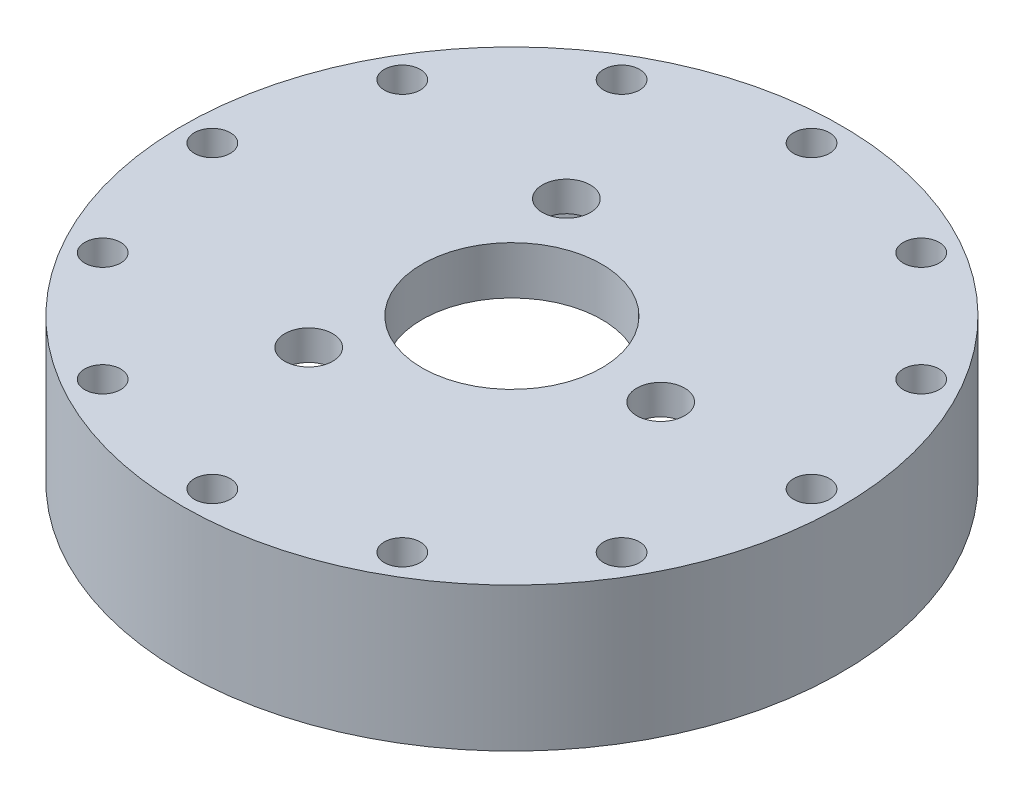
from build123d import *

# Parameters (mm, degrees)
SKETCH1_R           = 27.5
BOSS_EXTRUDE2_DEPTH = 8
SKETCH2_R           = 27.5
SKETCH2_R_2         = 7.5
SKETCH2_R_3         = 2
BOSS_EXTRUDE3_DEPTH = 4
FILLET2_R           = 1
SKETCH8_R           = 1.5
CUT_EXTRUDE1_DEPTH  = 41.700122985
SKETCH9_R           = 4.25
CUT_EXTRUDE2_DEPTH  = 1.5


with BuildPart() as part:
    # Sketch1 → Boss-Extrude2 (new body)
    with BuildSketch(Plane(origin=(0, 0, 0), x_dir=(1, 0, 0), z_dir=(0, 1, 0))):
        Circle(SKETCH1_R)
        with BuildLine():
            ThreePointArc((22.486051897, 0.792130095), (18.311696675, -2.632824508), (21.352039962, -7.095096155))
            ThreePointArc((21.352039962, -7.095096155), (20.466719895, -9.346837793), (19.34472846, -11.490495238))
            ThreePointArc((19.34472846, -11.490495238), (13.981367126, -12.114923578), (14.126580466, -17.512559046))
            ThreePointArc((14.126580466, -17.512559046), (12.164418393, -18.928204489), (10.06159042, -20.124969521))
            ThreePointArc((10.06159042, -20.124969521), (5.212052302, -17.750620012), (2.416031486, -22.369908177))
            ThreePointArc((2.416031486, -22.369908177), (0, -22.5), (-2.416031486, -22.369908177))
            ThreePointArc((-2.416031486, -22.369908177), (-5.212052302, -17.750620012), (-10.06159042, -20.124969521))
            ThreePointArc((-10.06159042, -20.124969521), (-12.164418393, -18.928204489), (-14.126580466, -17.512559046))
            ThreePointArc((-14.126580466, -17.512559046), (-13.981367126, -12.114923578), (-19.34472846, -11.490495238))
            ThreePointArc((-19.34472846, -11.490495238), (-20.466719895, -9.346837793), (-21.352039962, -7.095096155))
            ThreePointArc((-21.352039962, -7.095096155), (-18.311696675, -2.632824508), (-22.486051897, 0.792130095))
            ThreePointArc((-22.486051897, 0.792130095), (-22.270982442, 3.202083861), (-21.798377637, 5.575009634))
            ThreePointArc((-21.798377637, 5.575009634), (-16.828191914, 7.685177741), (-18.488212735, 12.82325972))
            ThreePointArc((-18.488212735, 12.82325972), (-17.004365423, 14.734366514), (-15.323884431, 16.475089254))
            ThreePointArc((-15.323884431, 16.475089254), (-10.001855123, 15.563190357), (-8.620496662, 20.783094988))
            ThreePointArc((-8.620496662, 20.783094988), (-6.338982529, 21.588591906), (-3.984166192, 22.144444444))
            ThreePointArc((-3.984166192, 22.144444444), (0, 18.5), (3.984166192, 22.144444444))
            ThreePointArc((3.984166192, 22.144444444), (6.338982529, 21.588591906), (8.620496662, 20.783094988))
            ThreePointArc((8.620496662, 20.783094988), (10.001855123, 15.563190357), (15.323884431, 16.475089254))
            ThreePointArc((15.323884431, 16.475089254), (17.004365423, 14.734366514), (18.488212735, 12.82325972))
            ThreePointArc((18.488212735, 12.82325972), (16.828191914, 7.685177741), (21.798377637, 5.575009634))
            ThreePointArc((21.798377637, 5.575009634), (22.270982442, 3.202083861), (22.486051897, 0.792130095))
        make_face(mode=Mode.SUBTRACT)
    extrude(amount=BOSS_EXTRUDE2_DEPTH)

    # Sketch2 → Boss-Extrude3 (add)
    with BuildSketch(Plane(origin=(0, 8, 0), x_dir=(1, 0, 0), z_dir=(0, 1, 0))):
        Circle(SKETCH2_R)
        Circle(SKETCH2_R_2, mode=Mode.SUBTRACT)
        with Locations((-6.206515394, 10.75)):
            Circle(SKETCH2_R_3, mode=Mode.SUBTRACT)
        with Locations((12.413030788, 0)):
            Circle(SKETCH2_R_3, mode=Mode.SUBTRACT)
        with Locations((-6.206515394, -10.75)):
            Circle(SKETCH2_R_3, mode=Mode.SUBTRACT)
    extrude(amount=BOSS_EXTRUDE3_DEPTH)

    # Fillet2
    fillet2_edges = [part.edges().sort_by_distance(p)[0] for p in [
        (19.34472846, 4, 11.490495238),
        (10.06159042, 4, 20.124969521),
        (2.416031486, 4, 22.369908177),
        (14.126580466, 4, 17.512559046),
        (-2.416031486, 4, 22.369908177),
        (-10.06159042, 4, 20.124969521),
        (-14.126580466, 4, 17.512559046),
        (-19.34472846, 4, 11.490495238),
        (-21.352039962, 4, 7.095096155),
        (-22.486051897, 4, -0.792130095),
        (-21.798377637, 4, -5.575009634),
        (-18.488212735, 4, -12.82325972),
        (-15.323884431, 4, -16.475089254),
        (-8.620496662, 4, -20.783094988),
        (-3.984166192, 4, -22.144444444),
        (3.984166192, 4, -22.144444444),
        (8.620496662, 4, -20.783094988),
        (15.323884431, 4, -16.475089254),
        (18.488212735, 4, -12.82325972),
        (21.798377637, 4, -5.575009634),
        (22.486051897, 4, -0.792130095),
        (21.352039962, 4, 7.095096155),
    ]]
    fillet(fillet2_edges, radius=FILLET2_R)

    # Sketch8 → Cut-Extrude1 (cut, through all)
    with BuildSketch(Plane.XZ):
        with Locations((0, -25)):
            Circle(SKETCH8_R)
        with Locations((-12.5, -21.650635095)):
            Circle(SKETCH8_R)
        with Locations((-21.650635095, -12.5)):
            Circle(SKETCH8_R)
        with Locations((-25, 0)):
            Circle(SKETCH8_R)
        with Locations((-21.650635095, 12.5)):
            Circle(SKETCH8_R)
        with Locations((-12.5, 21.650635095)):
            Circle(SKETCH8_R)
        with Locations((0, 25)):
            Circle(SKETCH8_R)
        with Locations((12.5, 21.650635095)):
            Circle(SKETCH8_R)
        with Locations((21.650635095, 12.5)):
            Circle(SKETCH8_R)
        with Locations((25, 0)):
            Circle(SKETCH8_R)
        with Locations((21.650635095, -12.5)):
            Circle(SKETCH8_R)
        with Locations((12.5, -21.650635095)):
            Circle(SKETCH8_R)
    extrude(amount=-CUT_EXTRUDE1_DEPTH, mode=Mode.SUBTRACT)

    # Sketch9 → Cut-Extrude2 (cut)
    with BuildSketch(Plane.XZ.offset(-8)):
        with Locations((12.413030788, 0)):
            Circle(SKETCH9_R)
        with Locations((-6.206515394, -10.75)):
            Circle(SKETCH9_R)
        with Locations((-6.206515394, 10.75)):
            Circle(SKETCH9_R)
    extrude(amount=-CUT_EXTRUDE2_DEPTH, mode=Mode.SUBTRACT)


solid = part.part
